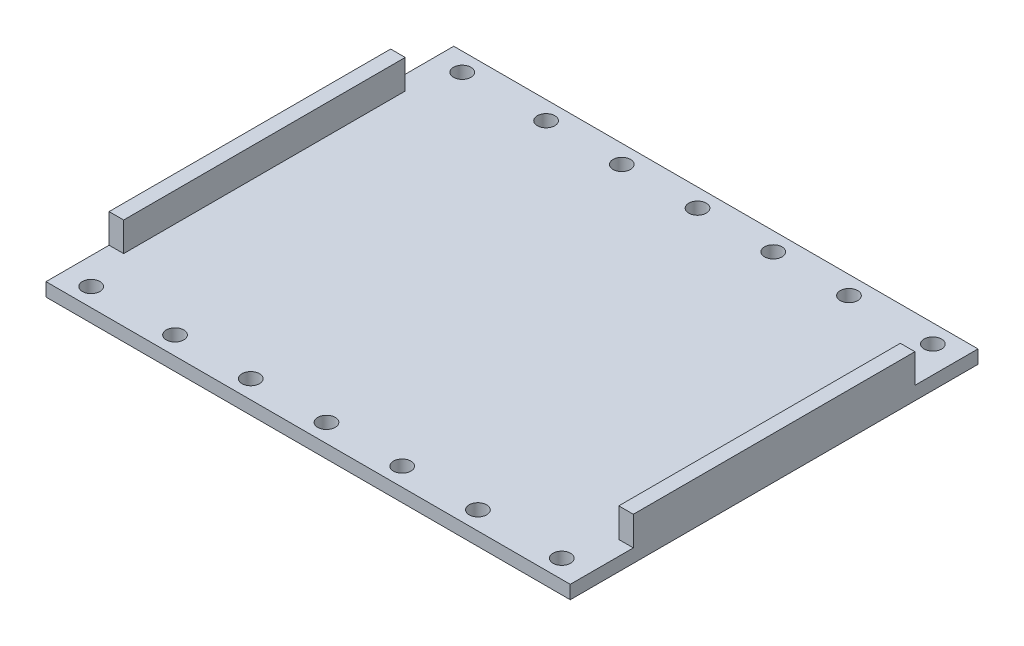
from build123d import *

# Parameters (mm, degrees)
SKETCH_1_W                  = 90
SKETCH_1_H                  = 70
SKETCH_1_R                  = 1.5
EXTRUDE_1_DEPTH             = 2.3
SKETCH_2_W                  = 2.5
SKETCH_2_H                  = 48.34
EXTRUDE_2_DEPTH             = 5
SKETCH_4_R                  = 1.5
CUT_EXTRUDE_1_DEPTH         = 10
PATTERN_LINEAR_1_COUNT      = 3
PATTERN_LINEAR_1_PITCH      = 13
PATTERN_LINEAR_1_COUNT_DIR2 = 3
PATTERN_LINEAR_1_PITCH_DIR2 = 13
MIRROR_2_COPY_1_SKETCH_R    = 1.5
MIRROR_2_COPY_1_DEPTH       = 10
MIRROR_2_COPY_2_SKETCH_R    = 1.5
MIRROR_2_COPY_2_DEPTH       = 10
MIRROR_2_COPY_3_SKETCH_R    = 1.5
MIRROR_2_COPY_3_DEPTH       = 10
MIRROR_2_COPY_4_SKETCH_R    = 1.5
MIRROR_2_COPY_4_DEPTH       = 10
MIRROR_2_COPY_5_SKETCH_R    = 1.5
MIRROR_2_COPY_5_DEPTH       = 10
MIRROR_2_COPY_6_SKETCH_R    = 1.5
MIRROR_2_COPY_6_DEPTH       = 10
MIRROR_2_COPY_7_SKETCH_R    = 1.5
MIRROR_2_COPY_7_DEPTH       = 10
MIRROR_2_COPY_8_SKETCH_R    = 1.5
MIRROR_2_COPY_8_DEPTH       = 10


with BuildPart() as part:
    # 草图1 → 凸台-拉伸1 (new body)
    with BuildSketch(Plane(origin=(0, 0, 0), x_dir=(1, 0, 0), z_dir=(0, 1, 0))):
        Rectangle(SKETCH_1_W, SKETCH_1_H)
        with Locations((40.4, -31.85)):
            Circle(SKETCH_1_R, mode=Mode.SUBTRACT)
        with Locations((-40.4, -31.85)):
            Circle(SKETCH_1_R, mode=Mode.SUBTRACT)
        with Locations((40.4, 31.85)):
            Circle(SKETCH_1_R, mode=Mode.SUBTRACT)
        with Locations((-40.4, 31.85)):
            Circle(SKETCH_1_R, mode=Mode.SUBTRACT)
    extrude(amount=EXTRUDE_1_DEPTH)

    # 草图2 → 凸台-拉伸2 (add)
    with BuildSketch(Plane(origin=(0, 2.3, 0), x_dir=(1, 0, 0), z_dir=(0, 1, 0))):
        with Locations((43.75, 0)):
            Rectangle(SKETCH_2_W, SKETCH_2_H)
    extrude_2 = extrude(amount=EXTRUDE_2_DEPTH)

    # 镜向1: 凸台-拉伸2 across plane
    add(extrude_2.mirror(Plane(origin=(0, 0, 0), x_dir=(0, 0, 1), z_dir=(1, 0, 0))))

    # 草图4 → 切除-拉伸1 (cut)
    with BuildSketch(Plane.XZ):
        with Locations((0, 31.85)):
            Circle(SKETCH_4_R)
    cut_extrude_1 = extrude(amount=-CUT_EXTRUDE_1_DEPTH, mode=Mode.SUBTRACT)

    # 阵列(线性)1: Cut-Extrude 1 3 × 3
    with Locations(*[Vector(-1, 0, 0) * (i * PATTERN_LINEAR_1_PITCH) + Vector(1, 0, 0) * (j * PATTERN_LINEAR_1_PITCH_DIR2) for i in range(PATTERN_LINEAR_1_COUNT) for j in range(PATTERN_LINEAR_1_COUNT_DIR2) if (i, j) != (0, 0)]):
        add(cut_extrude_1, mode=Mode.SUBTRACT)

    # 镜向2: 切除-拉伸1 across plane
    add(cut_extrude_1.mirror(Plane.XY), mode=Mode.SUBTRACT)

    # 镜向2 copy 1 sketch → 镜向2 copy 1 (cut)
    with BuildSketch(Plane(origin=(13, 0, 0), x_dir=(1, 0, 0), z_dir=(0, -1, 0))):
        with Locations((0, -31.85)):
            Circle(MIRROR_2_COPY_1_SKETCH_R)
    extrude(amount=-MIRROR_2_COPY_1_DEPTH, mode=Mode.SUBTRACT)

    # 镜向2 copy 2 sketch → 镜向2 copy 2 (cut)
    with BuildSketch(Plane(origin=(26, 0, 0), x_dir=(1, 0, 0), z_dir=(0, -1, 0))):
        with Locations((0, -31.85)):
            Circle(MIRROR_2_COPY_2_SKETCH_R)
    extrude(amount=-MIRROR_2_COPY_2_DEPTH, mode=Mode.SUBTRACT)

    # 镜向2 copy 3 sketch → 镜向2 copy 3 (cut)
    with BuildSketch(Plane(origin=(-13, 0, 0), x_dir=(1, 0, 0), z_dir=(0, -1, 0))):
        with Locations((0, -31.85)):
            Circle(MIRROR_2_COPY_3_SKETCH_R)
    extrude(amount=-MIRROR_2_COPY_3_DEPTH, mode=Mode.SUBTRACT)

    # 镜向2 copy 4 sketch → 镜向2 copy 4 (cut)
    with BuildSketch(Plane.XZ):
        with Locations((0, -31.85)):
            Circle(MIRROR_2_COPY_4_SKETCH_R)
    extrude(amount=-MIRROR_2_COPY_4_DEPTH, mode=Mode.SUBTRACT)

    # 镜向2 copy 5 sketch → 镜向2 copy 5 (cut)
    with BuildSketch(Plane(origin=(13, 0, 0), x_dir=(1, 0, 0), z_dir=(0, -1, 0))):
        with Locations((0, -31.85)):
            Circle(MIRROR_2_COPY_5_SKETCH_R)
    extrude(amount=-MIRROR_2_COPY_5_DEPTH, mode=Mode.SUBTRACT)

    # 镜向2 copy 6 sketch → 镜向2 copy 6 (cut)
    with BuildSketch(Plane(origin=(-26, 0, 0), x_dir=(1, 0, 0), z_dir=(0, -1, 0))):
        with Locations((0, -31.85)):
            Circle(MIRROR_2_COPY_6_SKETCH_R)
    extrude(amount=-MIRROR_2_COPY_6_DEPTH, mode=Mode.SUBTRACT)

    # 镜向2 copy 7 sketch → 镜向2 copy 7 (cut)
    with BuildSketch(Plane(origin=(-13, 0, 0), x_dir=(1, 0, 0), z_dir=(0, -1, 0))):
        with Locations((0, -31.85)):
            Circle(MIRROR_2_COPY_7_SKETCH_R)
    extrude(amount=-MIRROR_2_COPY_7_DEPTH, mode=Mode.SUBTRACT)

    # 镜向2 copy 8 sketch → 镜向2 copy 8 (cut)
    with BuildSketch(Plane.XZ):
        with Locations((0, -31.85)):
            Circle(MIRROR_2_COPY_8_SKETCH_R)
    extrude(amount=-MIRROR_2_COPY_8_DEPTH, mode=Mode.SUBTRACT)


solid = part.part
